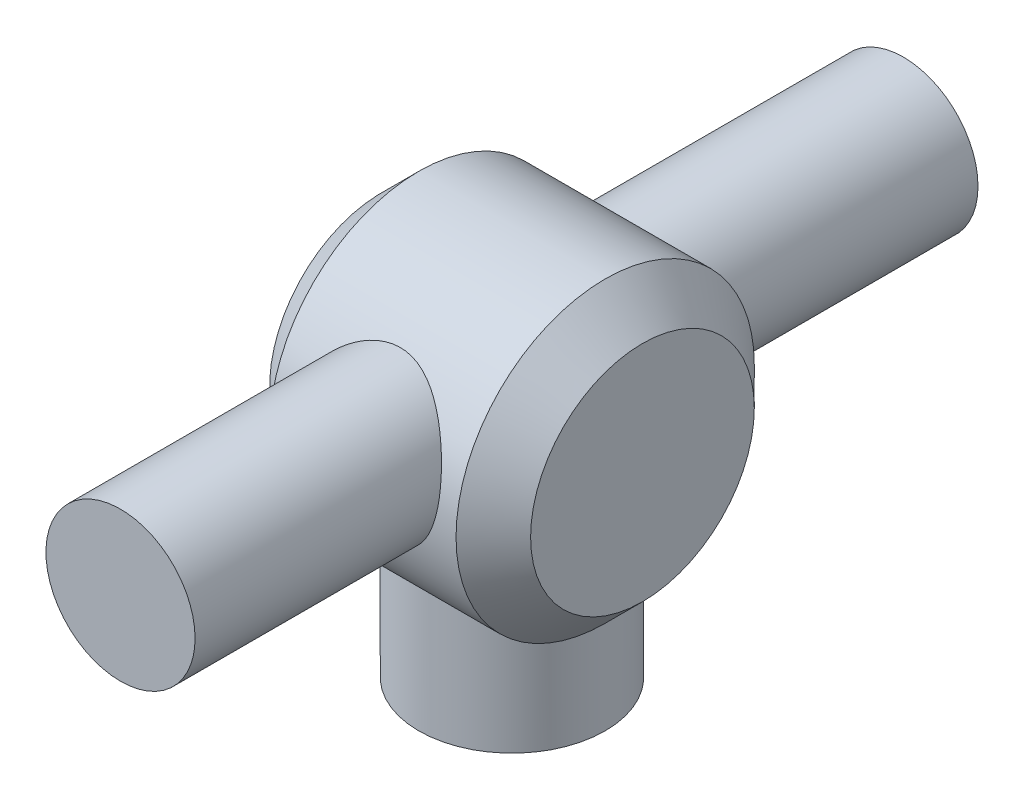
from build123d import *

# Parameters (mm, degrees)
SKETCH1_R           = 5
BOSS_EXTRUDE1_DEPTH = 10
SKETCH2_R           = 8
BOSS_EXTRUDE2_DEPTH = 7
SKETCH3_R           = 4
BOSS_EXTRUDE3_DEPTH = 21
CHAMFER1_SIZE       = 2


with BuildPart() as part:
    # Sketch1 → Boss-Extrude1 (new body)
    with BuildSketch(Plane(origin=(0, 0, 0), x_dir=(1, 0, 0), z_dir=(0, 1, 0))):
        with Locations(Location((0, 0, 0), (0, 0, 270))):
            Circle(SKETCH1_R)
    extrude(amount=BOSS_EXTRUDE1_DEPTH)

    # Sketch2 → Boss-Extrude2 (add, symmetric)
    with BuildSketch(Plane(origin=(0, 0, 0), x_dir=(0, 0, -1), z_dir=(1, 0, 0))):
        with Locations((0, 13)):
            Circle(SKETCH2_R)
    extrude(amount=BOSS_EXTRUDE2_DEPTH, both=True)

    # Sketch3 → Boss-Extrude3 (add, symmetric)
    with BuildSketch(Plane.XY):
        with Locations(Location((0, 14.305369128, 0), (0, 0, 180))):
            Circle(SKETCH3_R)
    extrude(amount=BOSS_EXTRUDE3_DEPTH, both=True)

    # Chamfer1
    chamfer1_edges = [part.edges().sort_by_distance(p)[0] for p in [
        (-7, 13, 8),
        (7, 13, 8),
    ]]
    chamfer(chamfer1_edges, length=CHAMFER1_SIZE - 0.0001)  # a hair under: the kernel refuses the full size


solid = part.part
